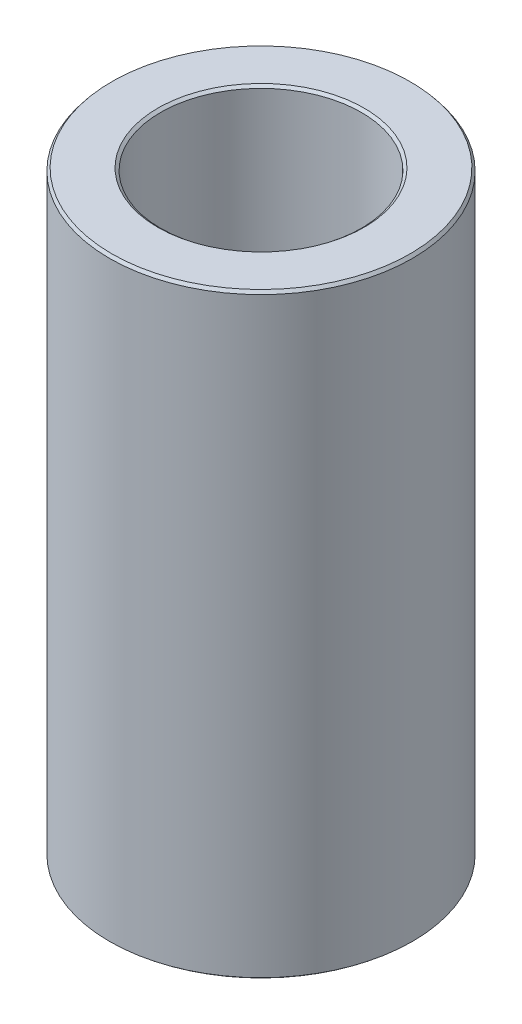
from build123d import *
from OCP.BRepFilletAPI import BRepFilletAPI_MakeChamfer

# Parameters (mm, degrees)
SKETCH1_R           = 45
BOSS_EXTRUDE1_DEPTH = 177.316452727
SKETCH2_R           = 29.835574569
CUT_EXTRUDE1_DEPTH  = 189.390881966
CHAMFER1_SIZE       = 0.845677919
CHAMFER1_SIZE2      = 0.673131119


with BuildPart() as part:
    # Sketch1 → Boss-Extrude1 (new body)
    with BuildSketch(Plane(origin=(0, 0, 0), x_dir=(1, 0, 0), z_dir=(0, 1, 0))):
        Circle(SKETCH1_R)
    extrude(amount=BOSS_EXTRUDE1_DEPTH)

    # Sketch2 → Cut-Extrude1 (cut, through all)
    with BuildSketch(Plane(origin=(0, 0, 0), x_dir=(1, 0, 0), z_dir=(0, 1, 0))):
        Circle(SKETCH2_R)
    extrude(amount=CUT_EXTRUDE1_DEPTH, mode=Mode.SUBTRACT)

    # Chamfer1: one chamfer whose edges measure the first distance from different faces: ONE call of the kernel's chamfer builder (chamfer() names one face for all edges)
    chamfer1_edges_1 = [part.edges().sort_by_distance(p)[0] for p in [
        (-29.835574569, 177.316452727, 0),
    ]]
    chamfer1_side_1 = [part.faces().sort_by_distance(p)[0] for p in [
        (-43.727207794, 177.316452727, 0),
    ]]
    chamfer1_edges_2 = [part.edges().sort_by_distance(p)[0] for p in [
        (-29.835574569, 0, 0),
    ]]
    chamfer1_side_2 = [part.faces().sort_by_distance(p)[0] for p in [
        (-29.835574569, 88.658226364, 0),
    ]]
    chamfer1_edges_3 = [part.edges().sort_by_distance(p)[0] for p in [
        (-45, 0, 0),
    ]]
    chamfer1_side_3 = [part.faces().sort_by_distance(p)[0] for p in [
        (-43.727207794, 0, 0),
    ]]
    chamfer1_edges_4 = [part.edges().sort_by_distance(p)[0] for p in [
        (-45, 177.316452727, 0),
    ]]
    chamfer1_side_4 = [part.faces().sort_by_distance(p)[0] for p in [
        (-45, 88.658226364, 0),
    ]]
    chamfer1 = BRepFilletAPI_MakeChamfer(part.part.solid().wrapped)
    for e in chamfer1_edges_1:
        chamfer1.Add(CHAMFER1_SIZE, CHAMFER1_SIZE2, e.wrapped, chamfer1_side_1[0].wrapped)  # the first distance lies on this face
    for e in chamfer1_edges_2:
        chamfer1.Add(CHAMFER1_SIZE, CHAMFER1_SIZE2, e.wrapped, chamfer1_side_2[0].wrapped)  # the first distance lies on this face
    for e in chamfer1_edges_3:
        chamfer1.Add(CHAMFER1_SIZE, CHAMFER1_SIZE2, e.wrapped, chamfer1_side_3[0].wrapped)  # the first distance lies on this face
    for e in chamfer1_edges_4:
        chamfer1.Add(CHAMFER1_SIZE, CHAMFER1_SIZE2, e.wrapped, chamfer1_side_4[0].wrapped)  # the first distance lies on this face
    add(Compound.cast(chamfer1.Shape()), mode=Mode.REPLACE)


solid = part.part
